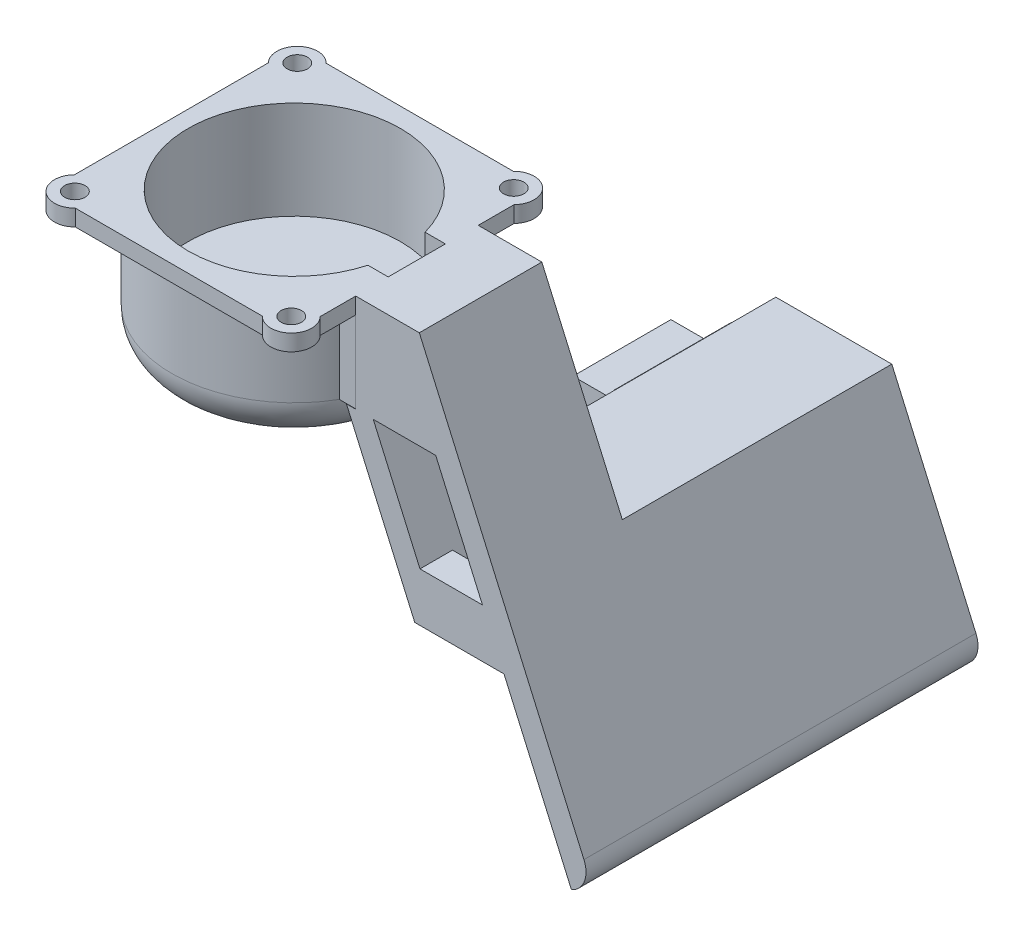
from build123d import *

# Parameters (mm, degrees)
SKETCH1_R            = 15
SKETCH1_R_2          = 13
SKETCH1_W            = 2
SKETCH1_H            = 30
BOSS_EXTRUDE3_DEPTH  = 12
BOSS_EXTRUDE4_START  = 5
SKETCH4_R            = 15
BOSS_EXTRUDE4_DEPTH  = 5
FILLET4_R            = 5
SKETCH7_W            = 7
SKETCH7_H            = 10
CUT_EXTRUDE3_DEPTH   = 18
SKETCH10_W           = 7.516685226
SKETCH10_H           = 12
CUT_EXTRUDE4_DEPTH   = 18
BOSS_EXTRUDE7_DEPTH  = 15
FILLET5_R            = 2
FILLET6_R            = 3
BOSS_EXTRUDE10_START = -3.98
BOSS_EXTRUDE10_DEPTH = 3.98
BOSS_EXTRUDE11_DEPTH = 3.98
FILLET7_START        = 3.536685226
FILLET7_DEPTH        = 3.98
BOSS_EXTRUDE12_START = -15
BOSS_EXTRUDE12_DEPTH = 15
FILLET8_R            = 3
BOSS_EXTRUDE13_START = -2
BOSS_EXTRUDE13_DEPTH = 2
SKETCH22_W           = 6
SKETCH22_H           = 13
CUT_EXTRUDE6_DEPTH   = 33
BOSS_EXTRUDE20_START = 30
BOSS_EXTRUDE20_DEPTH = 30
BOSS_EXTRUDE21_START = 3
BOSS_EXTRUDE21_DEPTH = 3
SKETCH29_W           = 14.429937618
SKETCH29_H           = 27.25
BOSS_EXTRUDE22_DEPTH = 3
SKETCH30_R           = 1.25
CUT_EXTRUDE7_DEPTH   = 8
SKETCH31_W           = 5
SKETCH31_H           = 1.443411809
SKETCH31_H_2         = 0.5
CUT_EXTRUDE9_DEPTH   = 0.6
BOSS_EXTRUDE23_START = 12
SKETCH32_W           = 12
SKETCH32_H           = 7.02060795
SKETCH32_R           = 1.25
BOSS_EXTRUDE23_DEPTH = 12
SKETCH33_W           = 4.250415628
SKETCH33_H           = 13
CUT_EXTRUDE10_DEPTH  = 15
SKETCH35_W           = 1.250415628
SKETCH35_H           = 7
BOSS_EXTRUDE31_DEPTH = 1
CUT_EXTRUDE16_START  = -11
CUT_EXTRUDE16_DEPTH  = 11
SKETCH40_W           = 4.250415628
SKETCH40_H           = 13
BOSS_EXTRUDE32_DEPTH = 3
BOSS_EXTRUDE33_DEPTH = 33
SKETCH42_R           = 3
CUT_EXTRUDE18_DEPTH  = 33
BOSS_EXTRUDE34_DEPTH = 33
BOSS_EXTRUDE36_DEPTH = 37
SKETCH45_W           = 4
SKETCH45_H           = 19
CUT_EXTRUDE21_DEPTH  = 29
CUT_EXTRUDE22_DEPTH  = 26
BOSS_EXTRUDE41_DEPTH = 5
SKETCH49_W           = 33
SKETCH49_H           = 13
BOSS_EXTRUDE42_DEPTH = 3
BOSS_EXTRUDE44_DEPTH = 15
SKETCH51_W           = 12
SKETCH51_H           = 7.02060795
CUT_EXTRUDE23_DEPTH  = 7
CUT_EXTRUDE24_DEPTH  = 2
FILLET10_R           = 3
SKETCH54_W           = 4
SKETCH54_H           = 4
CUT_EXTRUDE25_DEPTH  = 1
CUT_EXTRUDE26_DEPTH  = 10
FILLET11_R           = 3
BOSS_EXTRUDE48_DEPTH = 2


with BuildPart() as part:
    # Sketch1 → Boss-Extrude3 (new body)
    # profile 1 of 2: a face of its own
    with BuildSketch(Plane(origin=(0, 0, 0), x_dir=(1, 0, 0), z_dir=(0, 1, 0))):
        Circle(SKETCH1_R)
        with Locations(Location((0, 0, 0), (0, 0, 270))):
            Circle(SKETCH1_R_2, mode=Mode.SUBTRACT)
    # profile 2 of 2: a face of its own
    with BuildSketch(Plane(origin=(0, 0, 0), x_dir=(1, 0, 0), z_dir=(0, 1, 0))):
        with Locations((14, 0)):
            Rectangle(SKETCH1_W, SKETCH1_H)
    extrude(amount=BOSS_EXTRUDE3_DEPTH)

    # Sketch4 → Boss-Extrude4 (add)
    with BuildSketch(Plane.XZ.offset(BOSS_EXTRUDE4_START)):
        with Locations(Location((0, 0, 0), (0, 0, 270))):
            Circle(SKETCH4_R)
    extrude(amount=-BOSS_EXTRUDE4_DEPTH)

    # Fillet4
    fillet4_edges = [part.edges().sort_by_distance(p)[0] for p in [
        (0, -5, 15),
    ]]
    fillet(fillet4_edges, radius=FILLET4_R - 0.0001)  # a hair under: the kernel refuses the full size

    # Sketch7 → Cut-Extrude3 (cut)
    with BuildSketch(Plane(origin=(15, 0, 0), x_dir=(0, 0, -1), z_dir=(1, 0, 0))):
        with Locations((0, 7)):
            Rectangle(SKETCH7_W, SKETCH7_H)
    extrude(amount=-CUT_EXTRUDE3_DEPTH, mode=Mode.SUBTRACT)

    # Sketch10 → Cut-Extrude4 (cut)
    with BuildSketch(Plane.ZY.offset(-13)):
        with Locations((-11.241657387, 6)):
            Rectangle(SKETCH10_W, SKETCH10_H)
        with Locations((11.241657387, 6)):
            Rectangle(SKETCH10_W, SKETCH10_H)
    extrude(amount=-CUT_EXTRUDE4_DEPTH, mode=Mode.SUBTRACT)

    # Sketch11 → Boss-Extrude7 (add)
    with BuildSketch(Plane(origin=(0, 0, -7.483314774), x_dir=(-1, 0, 0), z_dir=(0, 0, -1))):
        Polygon((-20.871352475, 9), (-15, 9), (-15, 12), (-22.828469967, 12), (-40.969950033, -29.207500154), (-44.840544848, -37.99937027), (-10.064263909, -37.99937027), (-10.064263909, -34.99937027), (-40.241945102, -34.99937027), align=None)
        Polygon((-26.446145865, -25.99937027), (-15, 0), (-15, 2), (-16.304744994, 2), (-29.511879028, -27.99937027), (-10.064263909, -27.99937027), (-10.064263909, -25.99937027), align=None)
    extrude(amount=-BOSS_EXTRUDE7_DEPTH)

    # Fillet5
    fillet5_edges = [part.edges().sort_by_distance(p)[0] for p in [
        (29.511879028, -27.99937027, 0.016685226),
        (26.446145865, -25.99937027, 0.016685226),
    ]]
    fillet(fillet5_edges, radius=FILLET5_R)

    # Fillet6
    fillet6_edges = [part.edges().sort_by_distance(p)[0] for p in [
        (44.840544848, -37.99937027, 0.016685226),
        (40.241945102, -34.99937027, 0.016685226),
    ]]
    fillet(fillet6_edges, radius=FILLET6_R)

    # Sketch14 → Boss-Extrude10 (add)
    with BuildSketch(Plane(origin=(0, 0, -7.483314774), x_dir=(-1, 0, 0), z_dir=(0, 0, -1)).offset(BOSS_EXTRUDE10_START)):
        with BuildLine():
            Line((-10.064263909, -34.99937027), (-10.064263909, -27.99937027))
            Line((-10.064263909, -27.99937027), (-26.446145865, -27.99937027))
            Line((-26.446145865, -27.99937027), (-29.511879028, -27.99937027))
            Line((-29.511879028, -27.99937027), (-28.276609194, -25.193514203))
            Line((-28.276609194, -25.193514203), (-16.304744994, 2))
            Line((-16.304744994, 2), (-15, 2))
            Line((-15, 2), (-15, 9))
            Line((-15, 9), (-20.871352475, 9))
            Line((-20.871352475, 9), (-38.38904035, -30.79058617))
            ThreePointArc((-38.38904035, -30.79058617), (-38.155948817, -33.638523664), (-35.643345356, -34.99937027))
            Line((-35.643345356, -34.99937027), (-10.064263909, -34.99937027))
        make_face()
        with BuildLine():
            Line((-29.511879028, -27.99937027), (-26.446145865, -27.99937027))
            ThreePointArc((-26.446145865, -27.99937027), (-28.121214838, -27.092139199), (-28.276609194, -25.193514203))
            Line((-28.276609194, -25.193514203), (-29.511879028, -27.99937027))
        make_face()
    extrude(amount=BOSS_EXTRUDE10_DEPTH)

    # Sketch16 → Boss-Extrude11 (add)
    with BuildSketch(Plane.XY.offset(7.516685226)):
        with BuildLine():
            Line((15, 12), (15, 2))
            Line((15, 2), (16.304744994, 2))
            Line((16.304744994, 2), (28.276609194, -25.193514203))
            ThreePointArc((28.276609194, -25.193514203), (28.121214838, -27.092139199), (26.446145865, -27.99937027))
            Line((26.446145865, -27.99937027), (10.064263909, -27.99937027))
            Line((10.064263909, -27.99937027), (10.064263909, -37.99937027))
            Line((10.064263909, -37.99937027), (44.840544848, -37.99937027))
            Line((44.840544848, -37.99937027), (22.828469967, 12))
            Line((22.828469967, 12), (15, 12))
        make_face()
    extrude(amount=-BOSS_EXTRUDE11_DEPTH)

    # Fillet7: read off the stored shape, not the designer's step
    # Fillet7 outline → Fillet7 (cut)
    with BuildSketch(Plane.XY.offset(FILLET7_START)):
        with BuildLine():
            ThreePointArc((42.987640096, -33.79058617), (42.754548563, -36.638523664), (40.241945102, -37.99937027))
            Line((40.241945102, -37.99937027), (44.840544848, -37.99937027))
            Line((44.840544848, -37.99937027), (42.987640096, -33.79058617))
        make_face()
    extrude(amount=FILLET7_DEPTH, mode=Mode.SUBTRACT)

    # Sketch17 → Boss-Extrude12 (add)
    with BuildSketch(Plane(origin=(0, 0, -7.483314774), x_dir=(-1, 0, 0), z_dir=(0, 0, -1)).offset(BOSS_EXTRUDE12_START)):
        Polygon((-24.913279283, -24.99937027), (-13.90738046, 0), (-15, 0), (-26.446145865, -25.99937027), (-10.064263909, -25.99937027), (-10.064263909, -24.99937027), align=None)
    extrude(amount=BOSS_EXTRUDE12_DEPTH)

    # Fillet8
    fillet8_edges = [part.edges().sort_by_distance(p)[0] for p in [
        (24.913279283, -24.99937027, 0.016685226),
    ]]
    fillet(fillet8_edges, radius=FILLET8_R)

    # Sketch19 → Boss-Extrude13 (add)
    with BuildSketch(Plane(origin=(0, 12, 0), x_dir=(1, 0, 0), z_dir=(0, 1, 0)).offset(BOSS_EXTRUDE13_START)):
        with BuildLine():
            ThreePointArc((15.041559148, -11.874405375), (13.283987659, -11.118027221), (11.506356837, -11.82597786))
            Line((11.506356837, -11.82597786), (12.378050537, -12.721885274))
            ThreePointArc((12.378050537, -12.721885274), (13.735996679, -12.466246526), (14.499744236, -13.617792687))
            ThreePointArc((14.499744236, -13.617792687), (14.401290398, -14.10404513), (14.121437936, -14.513700101))
            Line((14.121437936, -14.513700101), (14.993131636, -15.409607515))
            ThreePointArc((14.993131636, -15.409607515), (15.55283656, -14.590297572), (15.749744236, -13.617792687))
            ThreePointArc((15.749744236, -13.617792687), (15.565941257, -12.676925343), (15.041559148, -11.874405375))
        make_face()
        with BuildLine():
            Line((12.378050537, -12.721885274), (11.506356837, -11.82597786))
            ThreePointArc((11.506356837, -11.82597786), (10.749978767, -13.583549491), (11.457929641, -15.361180325))
            ThreePointArc((11.457929641, -15.361180325), (13.21550104, -16.117558157), (14.993131636, -15.409607515))
            Line((14.993131636, -15.409607515), (14.121437936, -14.513700101))
            ThreePointArc((14.121437936, -14.513700101), (12.353836823, -14.489486387), (12.378050537, -12.721885274))
        make_face()
        with BuildLine():
            ThreePointArc((12.105833776, -8.857132075), (11.322740501, -9.838472826), (10.460324397, -10.750888964))
            Line((10.460324397, -10.750888964), (11.506356837, -11.82597786))
            ThreePointArc((11.506356837, -11.82597786), (13.283987659, -11.118027221), (15.041559148, -11.874405375))
            Line((15.041559148, -11.874405375), (12.105833776, -8.857132075))
        make_face()
        with BuildLine():
            Line((11.506356837, -11.82597786), (10.460324397, -10.750888964))
            ThreePointArc((10.460324397, -10.750888964), (9.524627224, -11.587988447), (8.522204121, -12.343906874))
            Line((8.522204121, -12.343906874), (11.457929641, -15.361180325))
            ThreePointArc((11.457929641, -15.361180325), (10.749978767, -13.583549491), (11.506356837, -11.82597786))
        make_face()
        with BuildLine():
            Line((10.460324397, -10.750888964), (9.840443212, -10.113788856))
            Line((9.840443212, -10.113788856), (8.048628384, -11.857176256))
            Line((8.048628384, -11.857176256), (8.522204121, -12.343906874))
            ThreePointArc((8.522204121, -12.343906874), (9.524627224, -11.587988447), (10.460324397, -10.750888964))
        make_face()
        with BuildLine():
            Line((11.632258039, -8.370401457), (9.840443212, -10.113788856))
            Line((9.840443212, -10.113788856), (10.460324397, -10.750888964))
            ThreePointArc((10.460324397, -10.750888964), (11.322740501, -9.838472826), (12.105833776, -8.857132075))
            Line((12.105833776, -8.857132075), (11.632258039, -8.370401457))
        make_face()
        with BuildLine():
            ThreePointArc((11.457929403, 15.361180081), (10.749978769, 13.583549321), (11.506356837, 11.82597786))
            Line((11.506356837, 11.82597786), (12.378050537, 12.721885274))
            ThreePointArc((12.378050537, 12.721885274), (12.353836823, 14.489486387), (14.121437936, 14.513700101))
            Line((14.121437936, 14.513700101), (14.993131636, 15.409607515))
            ThreePointArc((14.993131636, 15.409607515), (13.21550087, 16.117558155), (11.457929403, 15.361180081))
        make_face()
        with BuildLine():
            Line((12.378050537, 12.721885274), (11.506356837, 11.82597786))
            ThreePointArc((11.506356837, 11.82597786), (13.283987646, 11.11802722), (15.041559129, 11.874405355))
            ThreePointArc((15.041559129, 11.874405355), (15.565941252, 12.67692533), (15.749744236, 13.617792687))
            ThreePointArc((15.749744236, 13.617792687), (15.55283656, 14.590297572), (14.993131636, 15.409607515))
            Line((14.993131636, 15.409607515), (14.121437936, 14.513700101))
            ThreePointArc((14.121437936, 14.513700101), (14.401290398, 14.10404513), (14.499744236, 13.617792687))
            ThreePointArc((14.499744236, 13.617792687), (13.735996679, 12.466246526), (12.378050537, 12.721885274))
        make_face()
        with BuildLine():
            ThreePointArc((8.522204121, 12.343906874), (9.524627224, 11.587988447), (10.460324397, 10.750888964))
            Line((10.460324397, 10.750888964), (11.506356837, 11.82597786))
            ThreePointArc((11.506356837, 11.82597786), (10.749978769, 13.583549321), (11.457929403, 15.361180081))
            Line((11.457929403, 15.361180081), (8.522204121, 12.343906874))
        make_face()
        with BuildLine():
            Line((11.506356837, 11.82597786), (10.460324397, 10.750888964))
            ThreePointArc((10.460324397, 10.750888964), (11.322740501, 9.838472826), (12.105833776, 8.857132075))
            Line((12.105833776, 8.857132075), (15.041559129, 11.874405355))
            ThreePointArc((15.041559129, 11.874405355), (13.283987646, 11.11802722), (11.506356837, 11.82597786))
        make_face()
        with BuildLine():
            Line((10.460324397, 10.750888964), (9.943936297, 10.22015675))
            Line((9.943936297, 10.22015675), (11.735751125, 8.476769351))
            Line((11.735751125, 8.476769351), (12.105833776, 8.857132075))
            ThreePointArc((12.105833776, 8.857132075), (11.322740501, 9.838472826), (10.460324397, 10.750888964))
        make_face()
        with BuildLine():
            Line((8.15212147, 11.96354415), (9.943936297, 10.22015675))
            Line((9.943936297, 10.22015675), (10.460324397, 10.750888964))
            ThreePointArc((10.460324397, 10.750888964), (9.524627224, 11.587988447), (8.522204121, 12.343906874))
            Line((8.522204121, 12.343906874), (8.15212147, 11.96354415))
        make_face()
        with BuildLine():
            ThreePointArc((-14.993131636, 15.409607515), (-15.749509703, 13.652036083), (-15.04155911, 11.874405336))
            ThreePointArc((-15.04155911, 11.874405336), (-13.283987632, 11.11802722), (-11.506356837, 11.82597786))
            Line((-11.506356837, 11.82597786), (-12.378050537, 12.721885274))
            ThreePointArc((-12.378050537, 12.721885274), (-14.14565165, 12.746098988), (-14.121437936, 14.513700101))
            Line((-14.121437936, 14.513700101), (-14.993131636, 15.409607515))
        make_face()
        with BuildLine():
            Line((-12.378050537, 12.721885274), (-11.506356837, 11.82597786))
            ThreePointArc((-11.506356837, 11.82597786), (-10.946651913, 12.645287803), (-10.749744236, 13.617792687))
            ThreePointArc((-10.749744236, 13.617792687), (-10.933547237, 14.558660084), (-11.457929403, 15.361180081))
            ThreePointArc((-11.457929403, 15.361180081), (-13.21550087, 16.117558155), (-14.993131636, 15.409607515))
            Line((-14.993131636, 15.409607515), (-14.121437936, 14.513700101))
            ThreePointArc((-14.121437936, 14.513700101), (-12.763491794, 14.769338849), (-11.999744236, 13.617792687))
            ThreePointArc((-11.999744236, 13.617792687), (-12.098198075, 13.131540245), (-12.378050537, 12.721885274))
        make_face()
        with BuildLine():
            Line((-15.04155911, 11.874405336), (-12.105833776, 8.857132075))
            ThreePointArc((-12.105833776, 8.857132075), (-11.322740501, 9.838472826), (-10.460324397, 10.750888964))
            Line((-10.460324397, 10.750888964), (-11.506356837, 11.82597786))
            ThreePointArc((-11.506356837, 11.82597786), (-13.283987632, 11.11802722), (-15.04155911, 11.874405336))
        make_face()
        with BuildLine():
            Line((-11.506356837, 11.82597786), (-10.460324397, 10.750888964))
            ThreePointArc((-10.460324397, 10.750888964), (-9.524627224, 11.587988447), (-8.522204121, 12.343906874))
            Line((-8.522204121, 12.343906874), (-11.457929403, 15.361180081))
            ThreePointArc((-11.457929403, 15.361180081), (-10.933547237, 14.558660084), (-10.749744236, 13.617792687))
            ThreePointArc((-10.749744236, 13.617792687), (-10.946651913, 12.645287803), (-11.506356837, 11.82597786))
        make_face()
        with BuildLine():
            Line((-10.460324397, 10.750888964), (-9.824577234, 10.097482157))
            Line((-9.824577234, 10.097482157), (-8.032762406, 11.840869556))
            Line((-8.032762406, 11.840869556), (-8.522204121, 12.343906874))
            ThreePointArc((-8.522204121, 12.343906874), (-9.524627224, 11.587988447), (-10.460324397, 10.750888964))
        make_face()
        with BuildLine():
            Line((-11.616392061, 8.354094757), (-9.824577234, 10.097482157))
            Line((-9.824577234, 10.097482157), (-10.460324397, 10.750888964))
            ThreePointArc((-10.460324397, 10.750888964), (-11.322740501, 9.838472826), (-12.105833776, 8.857132075))
            Line((-12.105833776, 8.857132075), (-11.616392061, 8.354094757))
        make_face()
        with BuildLine():
            ThreePointArc((-10.460324397, -10.750888964), (-11.322740501, -9.838472826), (-12.105833776, -8.857132075))
            Line((-12.105833776, -8.857132075), (-15.041559036, -11.874405259))
            ThreePointArc((-15.041559036, -11.874405259), (-13.283987579, -11.11802722), (-11.506356837, -11.82597786))
            Line((-11.506356837, -11.82597786), (-10.460324397, -10.750888964))
        make_face()
        with BuildLine():
            ThreePointArc((-8.522204121, -12.343906874), (-9.524627224, -11.587988447), (-10.460324397, -10.750888964))
            Line((-10.460324397, -10.750888964), (-11.506356837, -11.82597786))
            ThreePointArc((-11.506356837, -11.82597786), (-10.946651913, -12.645287803), (-10.749744236, -13.617792687))
            ThreePointArc((-10.749744236, -13.617792687), (-10.933547206, -14.55866001), (-11.457929291, -15.361179966))
            Line((-11.457929291, -15.361179966), (-8.522204121, -12.343906874))
        make_face()
        with BuildLine():
            Line((-8.005385408, -11.812732086), (-9.797200235, -10.069344686))
            Line((-9.797200235, -10.069344686), (-10.460324397, -10.750888964))
            ThreePointArc((-10.460324397, -10.750888964), (-9.524627224, -11.587988447), (-8.522204121, -12.343906874))
            Line((-8.522204121, -12.343906874), (-8.005385408, -11.812732086))
        make_face()
        with BuildLine():
            Line((-10.460324397, -10.750888964), (-9.797200235, -10.069344686))
            Line((-9.797200235, -10.069344686), (-11.589015062, -8.325957287))
            Line((-11.589015062, -8.325957287), (-12.105833776, -8.857132075))
            ThreePointArc((-12.105833776, -8.857132075), (-11.322740501, -9.838472826), (-10.460324397, -10.750888964))
        make_face()
        with BuildLine():
            ThreePointArc((-11.506356837, -11.82597786), (-13.283987579, -11.11802722), (-15.041559036, -11.874405259))
            ThreePointArc((-15.041559036, -11.874405259), (-15.749509704, -13.65203603), (-14.993131636, -15.409607515))
            Line((-14.993131636, -15.409607515), (-14.121437936, -14.513700101))
            ThreePointArc((-14.121437936, -14.513700101), (-14.14565165, -12.746098988), (-12.378050537, -12.721885274))
            Line((-12.378050537, -12.721885274), (-11.506356837, -11.82597786))
        make_face()
        with BuildLine():
            ThreePointArc((-10.749744236, -13.617792687), (-10.946651913, -12.645287803), (-11.506356837, -11.82597786))
            Line((-11.506356837, -11.82597786), (-12.378050537, -12.721885274))
            ThreePointArc((-12.378050537, -12.721885274), (-12.098198075, -13.131540245), (-11.999744236, -13.617792687))
            ThreePointArc((-11.999744236, -13.617792687), (-12.763491794, -14.769338849), (-14.121437936, -14.513700101))
            Line((-14.121437936, -14.513700101), (-14.993131636, -15.409607515))
            ThreePointArc((-14.993131636, -15.409607515), (-13.215500789, -16.117558154), (-11.457929291, -15.361179966))
            ThreePointArc((-11.457929291, -15.361179966), (-10.933547206, -14.55866001), (-10.749744236, -13.617792687))
        make_face()
    extrude(amount=BOSS_EXTRUDE13_DEPTH)

    # Sketch22 → Cut-Extrude6 (cut)
    with BuildSketch(Plane(origin=(0, 0, -7.483314774), x_dir=(-1, 0, 0), z_dir=(0, 0, -1))):
        with Locations((-13.064263909, -31.49937027)):
            Rectangle(SKETCH22_W, SKETCH22_H)
    extrude(amount=-CUT_EXTRUDE6_DEPTH, mode=Mode.SUBTRACT)

    # Sketch27 → Boss-Extrude20 (add)
    with BuildSketch(Plane(origin=(0, 0, -7.483314774), x_dir=(-1, 0, 0), z_dir=(0, 0, -1)).offset(BOSS_EXTRUDE20_START)):
        with BuildLine():
            Line((-16.064263909, -37.99937027), (-16.064263909, -24.99937027))
            Line((-16.064263909, -24.99937027), (-20.314679537, -24.99937027))
            ThreePointArc((-20.314679537, -24.99937027), (-22.827282997, -23.638523664), (-23.06037453, -20.79058617))
            Line((-23.06037453, -20.79058617), (-37.264428545, -20.79058617))
            Line((-37.264428545, -20.79058617), (-42.987640096, -33.79058617))
            ThreePointArc((-42.987640096, -33.79058617), (-41.328705217, -32.203131286), (-39.033161002, -32.253675276))
            Line((-39.033161002, -32.253675276), (-35.307311054, -23.79058617))
            Line((-35.307311054, -23.79058617), (-24.685199093, -23.79058617))
            Line((-24.685199093, -23.79058617), (-21.939504099, -27.99937027))
            Line((-21.939504099, -27.99937027), (-19.064263909, -27.99937027))
            Line((-19.064263909, -27.99937027), (-19.064263909, -34.99937027))
            Line((-19.064263909, -34.99937027), (-37.241945102, -34.99937027))
            ThreePointArc((-37.241945102, -34.99937027), (-38.120624759, -37.120690613), (-40.241945102, -37.99937027))
            Line((-40.241945102, -37.99937027), (-16.064263909, -37.99937027))
        make_face()
        with BuildLine():
            Line((-42.987640096, -33.79058617), (-40.241945102, -37.99937027))
            ThreePointArc((-40.241945102, -37.99937027), (-38.120624759, -37.120690613), (-37.241945102, -34.99937027))
            Line((-37.241945102, -34.99937027), (-38.61712054, -34.99937027))
            Line((-38.61712054, -34.99937027), (-39.587257737, -33.512279381))
            Line((-39.587257737, -33.512279381), (-39.033161002, -32.253675276))
            ThreePointArc((-39.033161002, -32.253675276), (-41.328705217, -32.203131286), (-42.987640096, -33.79058617))
        make_face()
        with BuildLine():
            Line((-42.987640096, -33.79058617), (-40.241945102, -37.99937027))
            ThreePointArc((-40.241945102, -37.99937027), (-42.754548563, -36.638523664), (-42.987640096, -33.79058617))
        make_face()
    extrude(amount=-BOSS_EXTRUDE20_DEPTH)

    # Sketch28 → Boss-Extrude21 (add)
    with BuildSketch(Plane(origin=(0, 0, -37.483314774), x_dir=(-1, 0, 0), z_dir=(0, 0, -1)).offset(BOSS_EXTRUDE21_START)):
        with BuildLine():
            Line((-40.241945102, -37.99937027), (-42.987640096, -33.79058617))
            ThreePointArc((-42.987640096, -33.79058617), (-42.754548563, -36.638523664), (-40.241945102, -37.99937027))
        make_face()
        with BuildLine():
            ThreePointArc((-39.033161002, -32.253675276), (-41.328705217, -32.203131286), (-42.987640096, -33.79058617))
            Line((-42.987640096, -33.79058617), (-40.241945102, -37.99937027))
            ThreePointArc((-40.241945102, -37.99937027), (-38.120624759, -37.120690613), (-37.241945102, -34.99937027))
            Line((-37.241945102, -34.99937027), (-38.61712054, -34.99937027))
            Line((-38.61712054, -34.99937027), (-39.587257737, -33.512279381))
            Line((-39.587257737, -33.512279381), (-39.033161002, -32.253675276))
        make_face()
        with BuildLine():
            ThreePointArc((-20.314679537, -24.99937027), (-22.827282997, -23.638523664), (-23.06037453, -20.79058617))
            Line((-23.06037453, -20.79058617), (-37.264428545, -20.79058617))
            Line((-37.264428545, -20.79058617), (-42.987640096, -33.79058617))
            ThreePointArc((-42.987640096, -33.79058617), (-41.328705217, -32.203131286), (-39.033161002, -32.253675276))
            Line((-39.033161002, -32.253675276), (-35.307311054, -23.79058617))
            Line((-35.307311054, -23.79058617), (-24.685199093, -23.79058617))
            Line((-24.685199093, -23.79058617), (-21.939504099, -27.99937027))
            Line((-21.939504099, -27.99937027), (-19.064263909, -27.99937027))
            Line((-19.064263909, -27.99937027), (-19.064263909, -34.99937027))
            Line((-19.064263909, -34.99937027), (-37.241945102, -34.99937027))
            ThreePointArc((-37.241945102, -34.99937027), (-38.120624759, -37.120690613), (-40.241945102, -37.99937027))
            Line((-40.241945102, -37.99937027), (-16.064263909, -37.99937027))
            Line((-16.064263909, -37.99937027), (-16.064263909, -24.99937027))
            Line((-16.064263909, -24.99937027), (-20.314679537, -24.99937027))
        make_face()
        with BuildLine():
            Line((-35.307311054, -23.79058617), (-39.033161002, -32.253675276))
            ThreePointArc((-39.033161002, -32.253675276), (-37.729341641, -33.360216876), (-37.241945102, -34.99937027))
            Line((-37.241945102, -34.99937027), (-19.064263909, -34.99937027))
            Line((-19.064263909, -34.99937027), (-19.064263909, -27.99937027))
            Line((-19.064263909, -27.99937027), (-21.939504099, -27.99937027))
            Line((-21.939504099, -27.99937027), (-24.685199093, -23.79058617))
            Line((-24.685199093, -23.79058617), (-35.307311054, -23.79058617))
        make_face()
        with BuildLine():
            ThreePointArc((-37.241945102, -34.99937027), (-37.729341641, -33.360216876), (-39.033161002, -32.253675276))
            Line((-39.033161002, -32.253675276), (-39.587257737, -33.512279381))
            Line((-39.587257737, -33.512279381), (-38.61712054, -34.99937027))
            Line((-38.61712054, -34.99937027), (-37.241945102, -34.99937027))
        make_face()
    extrude(amount=-BOSS_EXTRUDE21_DEPTH)

    # Sketch29 → Boss-Extrude22 (add)
    with BuildSketch(Plane.ZY.offset(-16.064263909)):
        with Locations((-33.268345965, -29.39497822)):
            Rectangle(SKETCH29_W, SKETCH29_H)
    extrude(amount=BOSS_EXTRUDE22_DEPTH)

    # Sketch30 → Cut-Extrude7 (cut)
    with BuildSketch(Plane.ZY.offset(-13.064263909)):
        with Locations((-29.053377156, -19.76997822)):
            Circle(SKETCH30_R)
        with Locations((-35.053377156, -19.76997822)):
            Circle(SKETCH30_R)
        with Locations((-35.053377156, -39.01997822)):
            Circle(SKETCH30_R)
        with Locations((-29.053377156, -39.01997822)):
            Circle(SKETCH30_R)
    extrude(amount=-CUT_EXTRUDE7_DEPTH, mode=Mode.SUBTRACT)

    # Sketch31 → Cut-Extrude9 (cut)
    with BuildSketch(Plane.XZ.offset(37.99937027)):
        Polygon((16.064263909, -27.831671251), (16.064263909, -28.331671251), (21.064263909, -28.331671251), (21.064263909, -29.77508306), (21.064263909, -30.27508306), (21.423122774, -30.27508306), (21.423122774, -27.831671251), align=None)
        with Locations((18.564263909, -29.053377156)):
            Rectangle(SKETCH31_W, SKETCH31_H)
        with Locations((18.564263909, -30.02508306)):
            Rectangle(SKETCH31_W, SKETCH31_H_2)
        with Locations((18.564263909, -34.081671251)):
            Rectangle(SKETCH31_W, SKETCH31_H_2)
        with Locations((18.564263909, -35.053377156)):
            Rectangle(SKETCH31_W, SKETCH31_H)
        Polygon((21.60566903, -33.831671251), (21.064263909, -33.831671251), (21.064263909, -34.331671251), (21.064263909, -35.77508306), (16.064263909, -35.77508306), (16.064263909, -36.27508306), (21.60566903, -36.27508306), align=None)
    extrude(amount=-CUT_EXTRUDE9_DEPTH, mode=Mode.SUBTRACT)

    # Sketch32 → Boss-Extrude23 (add)
    # profile 1 of 2: a face of its own
    with BuildSketch(Plane.ZY.offset(-13.064263909).offset(BOSS_EXTRUDE23_START)):
        with Locations((-32.053377156, -20.280282195)):
            Rectangle(SKETCH32_W, SKETCH32_H)
        with Locations((-35.053377156, -19.76997822)):
            Circle(SKETCH32_R, mode=Mode.SUBTRACT)
        with Locations((-29.053377156, -19.76997822)):
            Circle(SKETCH32_R, mode=Mode.SUBTRACT)
    # profile 2 of 2: a face of its own
    with BuildSketch(Plane.ZY.offset(-13.064263909).offset(BOSS_EXTRUDE23_START)):
        with Locations((-32.053377156, -38.509674245)):
            Rectangle(SKETCH32_W, SKETCH32_H)
        with Locations((-29.053377156, -39.01997822)):
            Circle(SKETCH32_R, mode=Mode.SUBTRACT)
        with Locations((-35.053377156, -39.01997822)):
            Circle(SKETCH32_R, mode=Mode.SUBTRACT)
    extrude(amount=-BOSS_EXTRUDE23_DEPTH)

    # Sketch33 → Cut-Extrude10 (cut)
    with BuildSketch(Plane.XY.offset(7.516685226)):
        with Locations((18.189471723, -31.49937027)):
            Rectangle(SKETCH33_W, SKETCH33_H)
    extrude(amount=-CUT_EXTRUDE10_DEPTH, mode=Mode.SUBTRACT)

    # Sketch35 → Boss-Extrude31 (add)
    with BuildSketch(Plane.XY.offset(-7.483314774)):
        Polygon((20.314679537, -37.99937027), (20.314679537, -34.99937027), (19.064263909, -34.99937027), (19.064263909, -27.99937027), (20.314679537, -27.99937027), (20.314679537, -24.99937027), (16.064263909, -24.99937027), (16.064263909, -37.99937027), align=None)
        with Locations((19.689471723, -31.49937027)):
            Rectangle(SKETCH35_W, SKETCH35_H)
    extrude(amount=BOSS_EXTRUDE31_DEPTH)

    # Sketch38 → Cut-Extrude16 (cut)
    with BuildSketch(Plane.XY.offset(7.516685226).offset(CUT_EXTRUDE16_START)):
        with BuildLine():
            ThreePointArc((23.314679537, -21.99937027), (22.43599988, -24.120690613), (20.314679537, -24.99937027))
            Line((20.314679537, -24.99937027), (39.117333297, -24.99937027))
            Line((39.117333297, -24.99937027), (36.475851043, -18.99937027))
            Line((36.475851043, -18.99937027), (22.271797028, -18.99937027))
            Line((22.271797028, -18.99937027), (23.06037453, -20.79058617))
            ThreePointArc((23.06037453, -20.79058617), (23.250414963, -21.381747805), (23.314679537, -21.99937027))
        make_face()
        with BuildLine():
            Line((39.117333297, -24.99937027), (20.314679537, -24.99937027))
            Line((20.314679537, -24.99937027), (20.314679537, -37.99937027))
            Line((20.314679537, -37.99937027), (40.241945102, -37.99937027))
            ThreePointArc((40.241945102, -37.99937027), (37.729341641, -33.360216876), (42.987640096, -33.79058617))
            Line((42.987640096, -33.79058617), (39.117333297, -24.99937027))
        make_face()
        with BuildLine():
            ThreePointArc((42.987640096, -33.79058617), (37.729341641, -33.360216876), (40.241945102, -37.99937027))
            Line((40.241945102, -37.99937027), (42.987640096, -33.79058617))
        make_face()
        with BuildLine():
            Line((42.987640096, -33.79058617), (40.241945102, -37.99937027))
            ThreePointArc((40.241945102, -37.99937027), (42.363265446, -37.120690613), (43.241945102, -34.99937027))
            ThreePointArc((43.241945102, -34.99937027), (43.177680528, -34.381747805), (42.987640096, -33.79058617))
        make_face()
        with BuildLine():
            Line((40.241945102, -37.99937027), (42.987640096, -33.79058617))
            ThreePointArc((42.987640096, -33.79058617), (42.754548563, -36.638523664), (40.241945102, -37.99937027))
        make_face()
    extrude(amount=CUT_EXTRUDE16_DEPTH, mode=Mode.SUBTRACT)

    # Sketch40 → Boss-Extrude32 (add)
    with BuildSketch(Plane.XY.offset(-6.483314774)):
        with Locations((18.189471723, -31.49937027)):
            Rectangle(SKETCH40_W, SKETCH40_H)
    extrude(amount=BOSS_EXTRUDE32_DEPTH)

    # Sketch41 → Boss-Extrude33 (add)
    with BuildSketch(Plane(origin=(0, 0, -7.483314774), x_dir=(-1, 0, 0), z_dir=(0, 0, -1))):
        Polygon((-23.06037453, -20.79058617), (-19.538398192, -12.79058617), (-33.742452206, -12.79058617), (-37.264428545, -20.79058617), align=None)
        Polygon((-24.136997937, -15.79058617), (-25.017492022, -17.79058617), (-32.665828799, -17.79058617), (-31.785334715, -15.79058617), align=None, mode=Mode.SUBTRACT)
    extrude(amount=BOSS_EXTRUDE33_DEPTH)

    # Sketch42 → Cut-Extrude18 (cut)
    with BuildSketch(Plane(origin=(0, 0, -40.483314774), x_dir=(-1, 0, 0), z_dir=(0, 0, -1))):
        with Locations((-40.241945102, -34.99937027)):
            Circle(SKETCH42_R)
        with Locations((-20.314679537, -21.99937027)):
            Circle(SKETCH42_R)
        Polygon((-33.742452206, -12.79058617), (-42.987640096, -33.79058617), (-40.241945102, -37.99937027), (-16.064263909, -37.99937027), (-16.064263909, -24.99937027), (-20.314679537, -24.99937027), (-23.06037453, -20.79058617), (-19.538398192, -12.79058617), align=None)
    extrude(amount=-CUT_EXTRUDE18_DEPTH, mode=Mode.SUBTRACT)


with BuildPart() as cut_extrude18_piece_1:
    # of the separate pieces the step leaves, piece 1, a body of its own (cut_extrude18_pieces)
    add(part.part.solids().sort_by_distance((22.828469967, 12, -7.483314774))[0])



with BuildPart() as cut_extrude18_piece_2:
    # of the separate pieces the step leaves, piece 2, a body of its own (cut_extrude18_pieces)
    add(part.part.solids().sort_by_distance((16.064263909, -15.76997822, -40.483314774))[0])


with BuildPart() as cut_extrude18_piece_1_1:
    add(cut_extrude18_piece_1.part)

    add(cut_extrude18_piece_2.part)  # Boss-Extrude34 merges Cut-Extrude18 piece 2
    # Sketch43 → Boss-Extrude34 (add)
    with BuildSketch(Plane(origin=(0, 0, -7.483314774), x_dir=(-1, 0, 0), z_dir=(0, 0, -1))):
        with BuildLine():
            Line((-23.06037453, -20.79058617), (-18.483877495, -10.395293085))
            Line((-18.483877495, -10.395293085), (-32.68793151, -10.395293085))
            Line((-32.68793151, -10.395293085), (-42.987640096, -33.79058617))
            ThreePointArc((-42.987640096, -33.79058617), (-41.328705217, -32.203131286), (-39.033161002, -32.253675276))
            Line((-39.033161002, -32.253675276), (-30.730814018, -13.395293085))
            Line((-30.730814018, -13.395293085), (-23.082477241, -13.395293085))
            Line((-23.082477241, -13.395293085), (-26.46075689, -21.068892958))
            Line((-26.46075689, -21.068892958), (-21.939504099, -27.99937027))
            Line((-21.939504099, -27.99937027), (-19.064263909, -27.99937027))
            Line((-19.064263909, -27.99937027), (-19.064263909, -34.99937027))
            Line((-19.064263909, -34.99937027), (-37.241945102, -34.99937027))
            ThreePointArc((-37.241945102, -34.99937027), (-38.120624759, -37.120690613), (-40.241945102, -37.99937027))
            Line((-40.241945102, -37.99937027), (-16.064263909, -37.99937027))
            Line((-16.064263909, -37.99937027), (-16.064263909, -24.99937027))
            Line((-16.064263909, -24.99937027), (-20.314679537, -24.99937027))
            ThreePointArc((-20.314679537, -24.99937027), (-22.827282997, -23.638523664), (-23.06037453, -20.79058617))
        make_face()
        with BuildLine():
            ThreePointArc((-39.033161002, -32.253675276), (-41.328705217, -32.203131286), (-42.987640096, -33.79058617))
            Line((-42.987640096, -33.79058617), (-40.241945102, -37.99937027))
            ThreePointArc((-40.241945102, -37.99937027), (-38.120624759, -37.120690613), (-37.241945102, -34.99937027))
            Line((-37.241945102, -34.99937027), (-38.61712054, -34.99937027))
            Line((-38.61712054, -34.99937027), (-39.587257737, -33.512279381))
            Line((-39.587257737, -33.512279381), (-39.033161002, -32.253675276))
        make_face()
        with BuildLine():
            Line((-42.987640096, -33.79058617), (-40.241945102, -37.99937027))
            ThreePointArc((-40.241945102, -37.99937027), (-42.754548563, -36.638523664), (-42.987640096, -33.79058617))
        make_face()
    extrude(amount=BOSS_EXTRUDE34_DEPTH)

    # Sketch44 → Boss-Extrude36 (add)
    with BuildSketch(Plane(origin=(0, 0, -40.483314774), x_dir=(-1, 0, 0), z_dir=(0, 0, -1))):
        with BuildLine():
            Line((-30.730814018, -13.395293085), (-39.033161002, -32.253675276))
            ThreePointArc((-39.033161002, -32.253675276), (-37.729341641, -33.360216876), (-37.241945102, -34.99937027))
            Line((-37.241945102, -34.99937027), (-19.064263909, -34.99937027))
            Line((-19.064263909, -34.99937027), (-19.064263909, -27.99937027))
            Line((-19.064263909, -27.99937027), (-21.939504099, -27.99937027))
            Line((-21.939504099, -27.99937027), (-26.46075689, -21.068892958))
            Line((-26.46075689, -21.068892958), (-23.082477241, -13.395293085))
            Line((-23.082477241, -13.395293085), (-30.730814018, -13.395293085))
        make_face()
        with BuildLine():
            Line((-23.06037453, -20.79058617), (-18.483877495, -10.395293085))
            Line((-18.483877495, -10.395293085), (-32.68793151, -10.395293085))
            Line((-32.68793151, -10.395293085), (-42.987640096, -33.79058617))
            ThreePointArc((-42.987640096, -33.79058617), (-41.328705217, -32.203131286), (-39.033161002, -32.253675276))
            Line((-39.033161002, -32.253675276), (-30.730814018, -13.395293085))
            Line((-30.730814018, -13.395293085), (-23.082477241, -13.395293085))
            Line((-23.082477241, -13.395293085), (-26.46075689, -21.068892958))
            Line((-26.46075689, -21.068892958), (-21.939504099, -27.99937027))
            Line((-21.939504099, -27.99937027), (-19.064263909, -27.99937027))
            Line((-19.064263909, -27.99937027), (-19.064263909, -34.99937027))
            Line((-19.064263909, -34.99937027), (-37.241945102, -34.99937027))
            ThreePointArc((-37.241945102, -34.99937027), (-38.120624759, -37.120690613), (-40.241945102, -37.99937027))
            Line((-40.241945102, -37.99937027), (-16.064263909, -37.99937027))
            Line((-16.064263909, -37.99937027), (-16.064263909, -24.99937027))
            Line((-16.064263909, -24.99937027), (-20.314679537, -24.99937027))
            ThreePointArc((-20.314679537, -24.99937027), (-22.827282997, -23.638523664), (-23.06037453, -20.79058617))
        make_face()
        with BuildLine():
            ThreePointArc((-39.033161002, -32.253675276), (-41.328705217, -32.203131286), (-42.987640096, -33.79058617))
            Line((-42.987640096, -33.79058617), (-40.241945102, -37.99937027))
            ThreePointArc((-40.241945102, -37.99937027), (-38.120624759, -37.120690613), (-37.241945102, -34.99937027))
            Line((-37.241945102, -34.99937027), (-38.61712054, -34.99937027))
            Line((-38.61712054, -34.99937027), (-39.587257737, -33.512279381))
            Line((-39.587257737, -33.512279381), (-39.033161002, -32.253675276))
        make_face()
        with BuildLine():
            ThreePointArc((-37.241945102, -34.99937027), (-37.729341641, -33.360216876), (-39.033161002, -32.253675276))
            Line((-39.033161002, -32.253675276), (-39.587257737, -33.512279381))
            Line((-39.587257737, -33.512279381), (-38.61712054, -34.99937027))
            Line((-38.61712054, -34.99937027), (-37.241945102, -34.99937027))
        make_face()
        with BuildLine():
            Line((-40.241945102, -37.99937027), (-42.987640096, -33.79058617))
            ThreePointArc((-42.987640096, -33.79058617), (-42.754548563, -36.638523664), (-40.241945102, -37.99937027))
        make_face()
    extrude(amount=-BOSS_EXTRUDE36_DEPTH)

    # Sketch45 → Cut-Extrude21 (cut)
    with BuildSketch(Plane.ZY.offset(-16.064263909)):
        with Locations((-5.483314774, -28.49937027)):
            Rectangle(SKETCH45_W, SKETCH45_H)
    extrude(amount=-CUT_EXTRUDE21_DEPTH, mode=Mode.SUBTRACT)

    # Sketch47 → Cut-Extrude22 (cut)
    with BuildSketch(Plane(origin=(0, 0, -40.483314774), x_dir=(-1, 0, 0), z_dir=(0, 0, -1))):
        with BuildLine():
            Line((-23.082477241, -13.395293085), (-30.730814018, -13.395293085))
            Line((-30.730814018, -13.395293085), (-39.033161002, -32.253675276))
            ThreePointArc((-39.033161002, -32.253675276), (-37.729341641, -33.360216876), (-37.241945102, -34.99937027))
            Line((-37.241945102, -34.99937027), (-16.064263909, -34.99937027))
            Line((-16.064263909, -34.99937027), (-16.064263909, -27.99937027))
            Line((-16.064263909, -27.99937027), (-29.511879028, -27.99937027))
            Line((-29.511879028, -27.99937027), (-23.082477241, -13.395293085))
        make_face()
    extrude(amount=-CUT_EXTRUDE22_DEPTH, mode=Mode.SUBTRACT)

    # Sketch48 → Boss-Extrude41 (add)
    with BuildSketch(Plane(origin=(0, 0, -40.483314774), x_dir=(-1, 0, 0), z_dir=(0, 0, -1))):
        with BuildLine():
            Line((-40.241945102, -37.99937027), (-42.987640096, -33.79058617))
            ThreePointArc((-42.987640096, -33.79058617), (-42.754548563, -36.638523664), (-40.241945102, -37.99937027))
        make_face()
        with BuildLine():
            ThreePointArc((-39.033161002, -32.253675276), (-41.328705217, -32.203131286), (-42.987640096, -33.79058617))
            Line((-42.987640096, -33.79058617), (-40.241945102, -37.99937027))
            ThreePointArc((-40.241945102, -37.99937027), (-38.120624759, -37.120690613), (-37.241945102, -34.99937027))
            ThreePointArc((-37.241945102, -34.99937027), (-37.729341641, -33.360216876), (-39.033161002, -32.253675276))
        make_face()
        with BuildLine():
            Line((-18.483877495, -10.395293085), (-32.68793151, -10.395293085))
            Line((-32.68793151, -10.395293085), (-42.987640096, -33.79058617))
            ThreePointArc((-42.987640096, -33.79058617), (-41.328705217, -32.203131286), (-39.033161002, -32.253675276))
            Line((-39.033161002, -32.253675276), (-30.730814018, -13.395293085))
            Line((-30.730814018, -13.395293085), (-23.082477241, -13.395293085))
            Line((-23.082477241, -13.395293085), (-29.511879028, -27.99937027))
            Line((-29.511879028, -27.99937027), (-16.064263909, -27.99937027))
            Line((-16.064263909, -27.99937027), (-16.064263909, -24.99937027))
            Line((-16.064263909, -24.99937027), (-20.314679537, -24.99937027))
            ThreePointArc((-20.314679537, -24.99937027), (-22.827282997, -23.638523664), (-23.06037453, -20.79058617))
            Line((-23.06037453, -20.79058617), (-18.483877495, -10.395293085))
        make_face()
        with BuildLine():
            ThreePointArc((-37.241945102, -34.99937027), (-38.120624759, -37.120690613), (-40.241945102, -37.99937027))
            Line((-40.241945102, -37.99937027), (-16.064263909, -37.99937027))
            Line((-16.064263909, -37.99937027), (-16.064263909, -34.99937027))
            Line((-16.064263909, -34.99937027), (-37.241945102, -34.99937027))
        make_face()
        with BuildLine():
            Line((-16.064263909, -34.99937027), (-37.241945102, -34.99937027))
            ThreePointArc((-37.241945102, -34.99937027), (-37.729341641, -33.360216876), (-39.033161002, -32.253675276))
            Line((-39.033161002, -32.253675276), (-30.730814018, -13.395293085))
            Line((-30.730814018, -13.395293085), (-23.082477241, -13.395293085))
            Line((-23.082477241, -13.395293085), (-29.511879028, -27.99937027))
            Line((-29.511879028, -27.99937027), (-16.064263909, -27.99937027))
            Line((-16.064263909, -27.99937027), (-16.064263909, -34.99937027))
        make_face()
    extrude(amount=-BOSS_EXTRUDE41_DEPTH)

    # Sketch49 → Boss-Extrude42 (add)
    with BuildSketch(Plane.ZY.offset(-16.064263909)):
        with Locations((-23.983314774, -31.49937027)):
            Rectangle(SKETCH49_W, SKETCH49_H)
    extrude(amount=-BOSS_EXTRUDE42_DEPTH)

    # Sketch50 → Boss-Extrude44 (add)
    with BuildSketch(Plane.XY.offset(-7.483314774)):
        with BuildLine():
            Line((42.987640096, -33.79058617), (36.475851043, -18.99937027))
            Line((36.475851043, -18.99937027), (33.197992424, -18.99937027))
            Line((33.197992424, -18.99937027), (41.450729202, -37.745065264))
            ThreePointArc((41.450729202, -37.745065264), (43.038184086, -36.086130385), (42.987640096, -33.79058617))
        make_face()
    extrude(amount=BOSS_EXTRUDE44_DEPTH)

    # Sketch51 → Cut-Extrude23 (cut)
    with BuildSketch(Plane.ZY.offset(-1.064263909)):
        with Locations((-32.053377156, -20.280282195)):
            Rectangle(SKETCH51_W, SKETCH51_H)
        with Locations((-32.053377156, -38.509674245)):
            Rectangle(SKETCH51_W, SKETCH51_H)
    extrude(amount=-CUT_EXTRUDE23_DEPTH, mode=Mode.SUBTRACT)

    # Sketch53 → Cut-Extrude24 (cut)
    with BuildSketch(Plane.XY.offset(-7.483314774)):
        with BuildLine():
            Line((33.197992424, -18.99937027), (22.271797028, -18.99937027))
            Line((22.271797028, -18.99937027), (23.06037453, -20.79058617))
            ThreePointArc((23.06037453, -20.79058617), (23.250414963, -21.381747805), (23.314679537, -21.99937027))
            ThreePointArc((23.314679537, -21.99937027), (22.43599988, -24.120690613), (20.314679537, -24.99937027))
            Line((20.314679537, -24.99937027), (16.064263909, -24.99937027))
            Line((16.064263909, -24.99937027), (16.064263909, -37.99937027))
            Line((16.064263909, -37.99937027), (40.241945102, -37.99937027))
            ThreePointArc((40.241945102, -37.99937027), (37.306209676, -35.616992735), (39.033161002, -32.253675276))
            Line((39.033161002, -32.253675276), (33.197992424, -18.99937027))
        make_face()
        with BuildLine():
            Line((41.450729202, -37.745065264), (39.033161002, -32.253675276))
            ThreePointArc((39.033161002, -32.253675276), (37.306209676, -35.616992735), (40.241945102, -37.99937027))
            ThreePointArc((40.241945102, -37.99937027), (40.859567567, -37.935105696), (41.450729202, -37.745065264))
        make_face()
    extrude(amount=-CUT_EXTRUDE24_DEPTH, mode=Mode.SUBTRACT)

    # Fillet10
    fillet10_edges = [cut_extrude18_piece_1_1.edges().sort_by_distance(p)[0] for p in [
        (16.064263909, -31.49937027, -9.483314774),
    ]]
    fillet(fillet10_edges, radius=FILLET10_R)

    # Sketch54 → Cut-Extrude25 (cut)
    with BuildSketch(Plane.XZ.offset(37.99937027)):
        with Locations((18.064263909, -29.053377156)):
            Rectangle(SKETCH54_W, SKETCH54_H)
        with Locations((18.064263909, -35.053377156)):
            Rectangle(SKETCH54_W, SKETCH54_H)
    extrude(amount=-CUT_EXTRUDE25_DEPTH, mode=Mode.SUBTRACT)

    # Sketch55 → Cut-Extrude26 (cut)
    with BuildSketch(Plane.XY.offset(7.516685226)):
        Polygon((17.185239079, 0), (22.908173393, -12.99937027), (30.55651017, -12.99937027), (24.833575856, 0), align=None)
    extrude(amount=-CUT_EXTRUDE26_DEPTH, mode=Mode.SUBTRACT)

    # Fillet11
    fillet11_edges = [cut_extrude18_piece_1_1.edges().sort_by_distance(p)[0] for p in [
        (16.304744994, 2, 0.016685226),
        (15, 9, 0),
    ]]
    fillet(fillet11_edges, radius=FILLET11_R - 0.0001)  # a hair under: the kernel refuses the full size

    # Sketch62 → Boss-Extrude48 (add)
    with BuildSketch(Plane(origin=(0, 12, 0), x_dir=(1, 0, 0), z_dir=(0, 1, 0))):
        with BuildLine():
            Line((15.041559064, 7.483314774), (15.041559064, 11.874405288))
            Line((15.041559064, 11.874405288), (12.105833776, 8.857132075))
            ThreePointArc((12.105833776, 8.857132075), (12.571697017, 8.182446707), (13, 7.483314774))
            Line((13, 7.483314774), (15.041559064, 7.483314774))
        make_face()
        with BuildLine():
            Line((-11.457929409, 15.361180087), (11.457929409, 15.361180087))
            Line((11.457929409, 15.361180087), (8.522204121, 12.343906874))
            ThreePointArc((8.522204121, 12.343906874), (0, 15), (-8.522204121, 12.343906874))
            Line((-8.522204121, 12.343906874), (-11.457929409, 15.361180087))
        make_face()
        with BuildLine():
            Line((-15.041559064, 11.874405288), (-15.041559064, -11.874405288))
            Line((-15.041559064, -11.874405288), (-12.105833776, -8.857132075))
            ThreePointArc((-12.105833776, -8.857132075), (-15, 0), (-12.105833776, 8.857132075))
            Line((-12.105833776, 8.857132075), (-15.041559064, 11.874405288))
        make_face()
        with BuildLine():
            Line((-11.457929409, -15.361180087), (11.457929409, -15.361180087))
            Line((11.457929409, -15.361180087), (8.522204121, -12.343906874))
            ThreePointArc((8.522204121, -12.343906874), (0, -15), (-8.522204121, -12.343906874))
            Line((-8.522204121, -12.343906874), (-11.457929409, -15.361180087))
        make_face()
        with BuildLine():
            Line((15.041559064, -11.874405288), (15.041559064, -7.516685226))
            Line((15.041559064, -7.516685226), (15, -7.516685226))
            Line((15, -7.516685226), (15, -7.483314774))
            Line((15, -7.483314774), (13, -7.483314774))
            ThreePointArc((13, -7.483314774), (12.571697017, -8.182446707), (12.105833776, -8.857132075))
            Line((12.105833776, -8.857132075), (15.041559064, -11.874405288))
        make_face()
    extrude(amount=-BOSS_EXTRUDE48_DEPTH)


solid = cut_extrude18_piece_1_1.part
